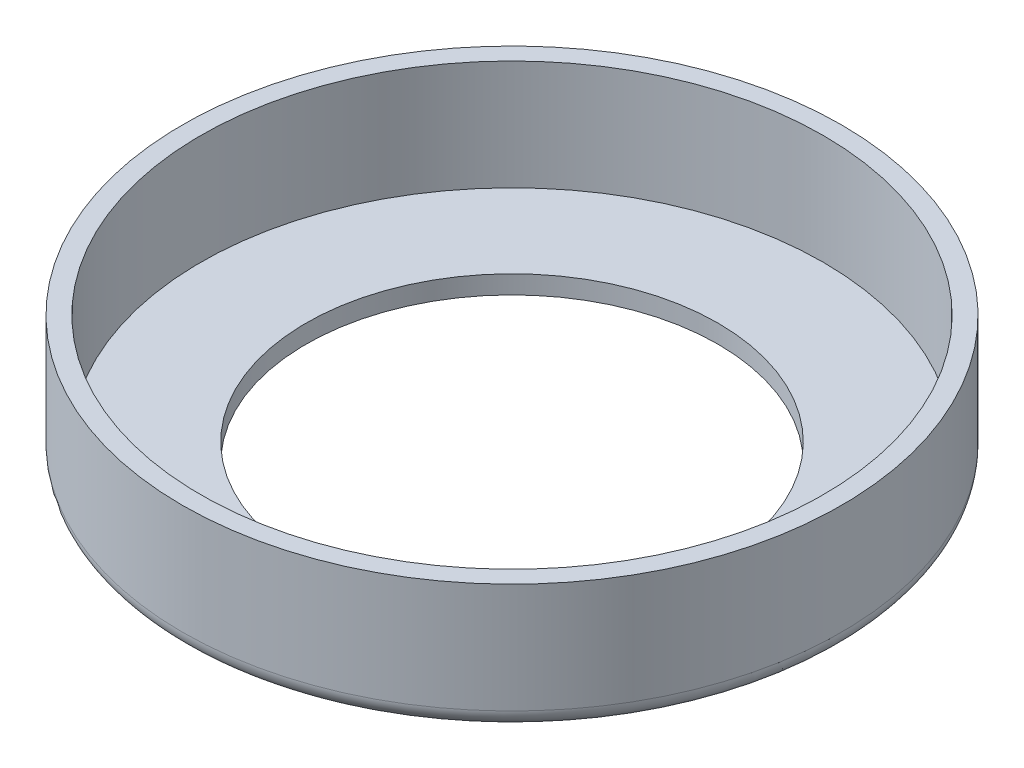
from build123d import *

# Parameters (mm, degrees)
CUT_EXTRUDE1_DEPTH   = 5
SKETCH6_R            = 10.5
CUT_EXTRUDE2_DEPTH   = 5
CUT_EXTRUDE3_DEPTH   = 45
SKETCH8_R            = 40
CUT_EXTRUDE4_DEPTH   = 32
SKETCH9_R            = 34
SKETCH9_R_2          = 24.5
CUT_EXTRUDE5_DEPTH   = 18
SKETCH10_R           = 27
CUT_EXTRUDE6_DEPTH   = 14
INTERSECT1_START     = 14
INTERSECT1_OUTLINE_R = 42
INTERSECT1_DEPTH     = 48


# Read off the part's stored shape, not the designer's step: Intersect1
with BuildPart() as part:
    # Sketch1 → Revolve1 (revolve)
    with BuildSketch(Plane.XY, mode=Mode.PRIVATE) as revolve1_sk:
        with BuildLine():
            Line((22.5, 0), (34, 0))
            ThreePointArc((34, 0), (35.414213562, 0.585786438), (36, 2))
            Line((36, 2), (36, 20))
            Line((36, 20), (40, 20))
            ThreePointArc((40, 20), (41.414213562, 20.585786438), (42, 22))
            Line((42, 22), (42, 57))
            ThreePointArc((42, 57), (40.535533906, 60.535533906), (37, 62))
            Line((37, 62), (0, 62))
            Line((0, 62), (0, 20))
            Line((0, 20), (22.5, 20))
            Line((22.5, 20), (22.5, 0))
        make_face()
    revolve(revolve1_sk.sketch.rotate(Axis((0, 2, 0), (0, 1, 0)), 90), axis=Axis((0, 2, 0), (0, 1, 0)))

    # Sketch5 → Cut-Extrude1 (cut)
    with BuildSketch(Plane(origin=(0, 62, 0), x_dir=(1, 0, 0), z_dir=(0, 1, 0))):
        with BuildLine():
            Line((-42, 0), (-40, 0))
            Line((-40, 0), (40, 0))
            Line((40, 0), (42, 0))
            ThreePointArc((42, 0), (0, 42), (-42, 0))
        make_face()
    extrude(amount=-CUT_EXTRUDE1_DEPTH, mode=Mode.SUBTRACT)

    # Sketch6 → Cut-Extrude2 (cut)
    with BuildSketch(Plane.XY.offset(42)):
        with Locations((-2, 42)):
            Circle(SKETCH6_R)
    extrude(amount=-CUT_EXTRUDE2_DEPTH, mode=Mode.SUBTRACT)

    # Sketch7 → Cut-Extrude3 (cut)
    with BuildSketch(Plane.XZ.offset(-20)):
        with BuildLine():
            Line((-21, 0), (21, 0))
            ThreePointArc((21, 0), (0, -21), (-21, 0))
        make_face()
    extrude(amount=-CUT_EXTRUDE3_DEPTH, mode=Mode.SUBTRACT)

    # Sketch8 → Cut-Extrude4 (cut)
    with BuildSketch(Plane(origin=(0, 54.5, 0), x_dir=(1, 0, 0), z_dir=(0, 1, 0))):
        with Locations(Location((0, 0, 0), (0, 0, 270))):
            Circle(SKETCH8_R)
        with BuildLine():
            Line((22.912878475, -2), (-22.912878475, -2))
            ThreePointArc((-22.912878475, -2), (0, 23), (22.912878475, -2))
        make_face(mode=Mode.SUBTRACT)
    extrude(amount=-CUT_EXTRUDE4_DEPTH, mode=Mode.SUBTRACT)

    # Sketch9 → Cut-Extrude5 (cut)
    with BuildSketch(Plane(origin=(0, 2, 0), x_dir=(-1, 0, 0), z_dir=(0, -1, 0))):
        with Locations(Location((0, 0, 0), (0, 0, 90))):
            Circle(SKETCH9_R)
        with Locations(Location((0, 0, 0), (0, 0, 90))):
            Circle(SKETCH9_R_2, mode=Mode.SUBTRACT)
    extrude(amount=-CUT_EXTRUDE5_DEPTH, mode=Mode.SUBTRACT)

    # Sketch10 → Cut-Extrude6 (cut)
    with BuildSketch(Plane(origin=(0, 2, 0), x_dir=(-1, 0, 0), z_dir=(0, -1, 0))):
        Circle(SKETCH10_R)
    extrude(amount=-CUT_EXTRUDE6_DEPTH, mode=Mode.SUBTRACT)

    # Intersect1 outline → Intersect1 (cut)
    with BuildSketch(Plane(origin=(0, 0, 0), x_dir=(1, 0, 0), z_dir=(0, 1, 0)).offset(INTERSECT1_START)):
        Circle(INTERSECT1_OUTLINE_R)
        with BuildLine():
            ThreePointArc((-21, 0), (0, 21), (21, 0))
            Line((21, 0), (-21, 0))
        make_face(mode=Mode.SUBTRACT)
    extrude(amount=INTERSECT1_DEPTH, mode=Mode.SUBTRACT)


solid = part.part
